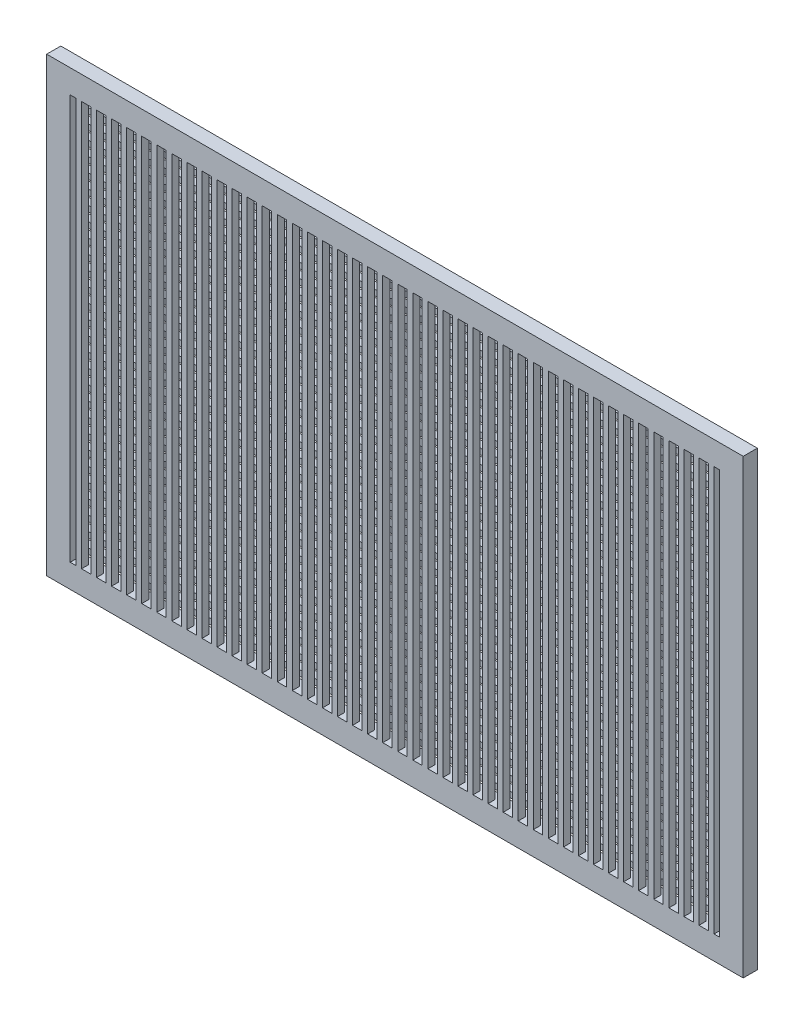
from build123d import *

# Parameters (mm, degrees)
BOSS_EXTRUDE1_DEPTH      = 0.75
BOSS_EXTRUDE1_DEPTH_BACK = 0.75
SKETCH1_W                = 74
SKETCH1_H                = 48
SKETCH1_W_2              = 69
SKETCH1_H_2              = 43
SKETCH2_W                = 69
SKETCH2_H                = 0.6
BOSS_EXTRUDE2_DEPTH      = 0.75
SKETCH3_W                = 0.6
SKETCH3_H                = 43
BOSS_EXTRUDE3_DEPTH      = 0.75


with BuildPart() as part:
    # Sketch1 → Boss-Extrude1 (new, two sides: drawn at the far end of the back side and taken through both)
    with BuildSketch(Plane.XY.offset(-BOSS_EXTRUDE1_DEPTH_BACK)):
        Rectangle(SKETCH1_W, SKETCH1_H)
        Rectangle(SKETCH1_W_2, SKETCH1_H_2, mode=Mode.SUBTRACT)
    extrude(amount=BOSS_EXTRUDE1_DEPTH + BOSS_EXTRUDE1_DEPTH_BACK)

    # Sketch2 → Boss-Extrude2 (add)
    with BuildSketch(Plane.XY):
        with Locations((0, -20.25)):
            Rectangle(SKETCH2_W, SKETCH2_H)
        with Locations((0, -18.75)):
            Rectangle(SKETCH2_W, SKETCH2_H)
        with Locations((0, -17.25)):
            Rectangle(SKETCH2_W, SKETCH2_H)
        with Locations((0, -15.75)):
            Rectangle(SKETCH2_W, SKETCH2_H)
        with Locations((0, -14.25)):
            Rectangle(SKETCH2_W, SKETCH2_H)
        with Locations((0, -12.75)):
            Rectangle(SKETCH2_W, SKETCH2_H)
        with Locations((0, -11.25)):
            Rectangle(SKETCH2_W, SKETCH2_H)
        with Locations((0, -9.75)):
            Rectangle(SKETCH2_W, SKETCH2_H)
        with Locations((0, -8.25)):
            Rectangle(SKETCH2_W, SKETCH2_H)
        with Locations((0, -6.75)):
            Rectangle(SKETCH2_W, SKETCH2_H)
        with Locations((0, -5.25)):
            Rectangle(SKETCH2_W, SKETCH2_H)
        with Locations((0, -3.75)):
            Rectangle(SKETCH2_W, SKETCH2_H)
        with Locations((0, -2.25)):
            Rectangle(SKETCH2_W, SKETCH2_H)
        with Locations((0, -0.75)):
            Rectangle(SKETCH2_W, SKETCH2_H)
        with Locations((0, 0.75)):
            Rectangle(SKETCH2_W, SKETCH2_H)
        with Locations((0, 2.25)):
            Rectangle(SKETCH2_W, SKETCH2_H)
        with Locations((0, 3.75)):
            Rectangle(SKETCH2_W, SKETCH2_H)
        with Locations((0, 5.25)):
            Rectangle(SKETCH2_W, SKETCH2_H)
        with Locations((0, 6.75)):
            Rectangle(SKETCH2_W, SKETCH2_H)
        with Locations((0, 8.25)):
            Rectangle(SKETCH2_W, SKETCH2_H)
        with Locations((0, 9.75)):
            Rectangle(SKETCH2_W, SKETCH2_H)
        with Locations((0, 11.25)):
            Rectangle(SKETCH2_W, SKETCH2_H)
        with Locations((0, 12.75)):
            Rectangle(SKETCH2_W, SKETCH2_H)
        with Locations((0, 14.25)):
            Rectangle(SKETCH2_W, SKETCH2_H)
        with Locations((0, 15.75)):
            Rectangle(SKETCH2_W, SKETCH2_H)
        with Locations((0, 17.25)):
            Rectangle(SKETCH2_W, SKETCH2_H)
        with Locations((0, 18.75)):
            Rectangle(SKETCH2_W, SKETCH2_H)
        with Locations((0, 20.25)):
            Rectangle(SKETCH2_W, SKETCH2_H)
    extrude(amount=-BOSS_EXTRUDE2_DEPTH)

    # Sketch3 → Boss-Extrude3 (add)
    with BuildSketch(Plane.XY):
        with Locations((-33.6, 0)):
            Rectangle(SKETCH3_W, SKETCH3_H)
        with Locations((-32, 0)):
            Rectangle(SKETCH3_W, SKETCH3_H)
        with Locations((-30.4, 0)):
            Rectangle(SKETCH3_W, SKETCH3_H)
        with Locations((-28.8, 0)):
            Rectangle(SKETCH3_W, SKETCH3_H)
        with Locations((-27.2, 0)):
            Rectangle(SKETCH3_W, SKETCH3_H)
        with Locations((-25.6, 0)):
            Rectangle(SKETCH3_W, SKETCH3_H)
        with Locations((-24, 0)):
            Rectangle(SKETCH3_W, SKETCH3_H)
        with Locations((-22.4, 0)):
            Rectangle(SKETCH3_W, SKETCH3_H)
        with Locations((-20.8, 0)):
            Rectangle(SKETCH3_W, SKETCH3_H)
        with Locations((-19.2, 0)):
            Rectangle(SKETCH3_W, SKETCH3_H)
        with Locations((-17.6, 0)):
            Rectangle(SKETCH3_W, SKETCH3_H)
        with Locations((-16, 0)):
            Rectangle(SKETCH3_W, SKETCH3_H)
        with Locations((-14.4, 0)):
            Rectangle(SKETCH3_W, SKETCH3_H)
        with Locations((-12.8, 0)):
            Rectangle(SKETCH3_W, SKETCH3_H)
        with Locations((-11.2, 0)):
            Rectangle(SKETCH3_W, SKETCH3_H)
        with Locations((-9.6, 0)):
            Rectangle(SKETCH3_W, SKETCH3_H)
        with Locations((-8, 0)):
            Rectangle(SKETCH3_W, SKETCH3_H)
        with Locations((-6.4, 0)):
            Rectangle(SKETCH3_W, SKETCH3_H)
        with Locations((-4.8, 0)):
            Rectangle(SKETCH3_W, SKETCH3_H)
        with Locations((-3.2, 0)):
            Rectangle(SKETCH3_W, SKETCH3_H)
        with Locations((-1.6, 0)):
            Rectangle(SKETCH3_W, SKETCH3_H)
        Rectangle(SKETCH3_W, SKETCH3_H)
        with Locations((1.6, 0)):
            Rectangle(SKETCH3_W, SKETCH3_H)
        with Locations((3.2, 0)):
            Rectangle(SKETCH3_W, SKETCH3_H)
        with Locations((4.8, 0)):
            Rectangle(SKETCH3_W, SKETCH3_H)
        with Locations((6.4, 0)):
            Rectangle(SKETCH3_W, SKETCH3_H)
        with Locations((8, 0)):
            Rectangle(SKETCH3_W, SKETCH3_H)
        with Locations((9.6, 0)):
            Rectangle(SKETCH3_W, SKETCH3_H)
        with Locations((11.2, 0)):
            Rectangle(SKETCH3_W, SKETCH3_H)
        with Locations((12.8, 0)):
            Rectangle(SKETCH3_W, SKETCH3_H)
        with Locations((14.4, 0)):
            Rectangle(SKETCH3_W, SKETCH3_H)
        with Locations((16, 0)):
            Rectangle(SKETCH3_W, SKETCH3_H)
        with Locations((17.6, 0)):
            Rectangle(SKETCH3_W, SKETCH3_H)
        with Locations((19.2, 0)):
            Rectangle(SKETCH3_W, SKETCH3_H)
        with Locations((20.8, 0)):
            Rectangle(SKETCH3_W, SKETCH3_H)
        with Locations((22.4, 0)):
            Rectangle(SKETCH3_W, SKETCH3_H)
        with Locations((24, 0)):
            Rectangle(SKETCH3_W, SKETCH3_H)
        with Locations((25.6, 0)):
            Rectangle(SKETCH3_W, SKETCH3_H)
        with Locations((27.2, 0)):
            Rectangle(SKETCH3_W, SKETCH3_H)
        with Locations((28.8, 0)):
            Rectangle(SKETCH3_W, SKETCH3_H)
        with Locations((30.4, 0)):
            Rectangle(SKETCH3_W, SKETCH3_H)
        with Locations((32, 0)):
            Rectangle(SKETCH3_W, SKETCH3_H)
        with Locations((33.6, 0)):
            Rectangle(SKETCH3_W, SKETCH3_H)
    extrude(amount=BOSS_EXTRUDE3_DEPTH)


solid = part.part
